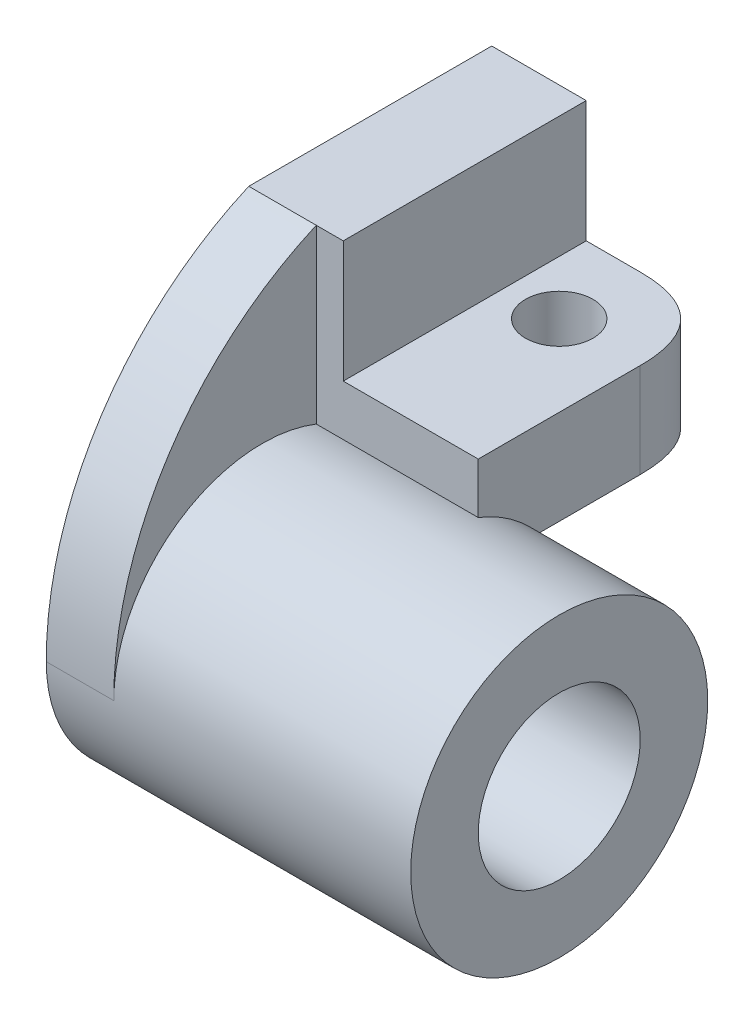
from build123d import *

# Parameters (mm, degrees)
SKETCH1_R           = 34.925
SKETCH1_R_2         = 19.05
BOSS_EXTRUDE1_DEPTH = 85.725
BOSS_EXTRUDE2_DEPTH = 53.975
SKETCH1_4_W         = 57.15
SKETCH1_4_H         = 28.575
BOSS_EXTRUDE3_DEPTH = 22.225
BOSS_EXTRUDE4_DEPTH = 15.875
FILLET1_SIZE        = 19.05
SKETCH2_R           = 7.9375
CUT_EXTRUDE1_DEPTH  = 137.118289601


with BuildPart() as part:
    # Sketch1 → Boss-Extrude1 (new body)
    with BuildSketch(Plane(origin=(0, 0, 0), x_dir=(0, 0, -1), z_dir=(1, 0, 0))):
        Circle(SKETCH1_R)
        Circle(SKETCH1_R_2, mode=Mode.SUBTRACT)
    extrude(amount=BOSS_EXTRUDE1_DEPTH)

    # Sketch1<3> → Boss-Extrude2 (add)
    with BuildSketch(Plane(origin=(0, 0, 0), x_dir=(0, 0, -1), z_dir=(1, 0, 0))):
        with BuildLine():
            Line((69.85, 44.45), (12.7, 44.45))
            Line((12.7, 44.45), (12.7, 32.534068682))
            ThreePointArc((12.7, 32.534068682), (20.479669269, 28.290259306), (26.940768363, 22.225))
            Line((26.940768363, 22.225), (69.85, 22.225))
            Line((69.85, 22.225), (69.85, 44.45))
        make_face()
    extrude(amount=BOSS_EXTRUDE2_DEPTH)

    # Sketch1<4> → Boss-Extrude3 (add)
    with BuildSketch(Plane(origin=(0, 0, 0), x_dir=(0, 0, -1), z_dir=(1, 0, 0))):
        with Locations((41.275, 58.7375)):
            Rectangle(SKETCH1_4_W, SKETCH1_4_H)
    extrude(amount=BOSS_EXTRUDE3_DEPTH)

    # Sketch1<5> → Boss-Extrude4 (add)
    with BuildSketch(Plane(origin=(0, 0, 0), x_dir=(0, 0, -1), z_dir=(1, 0, 0))):
        with BuildLine():
            Line((12.7, 32.534068682), (12.7, 44.45))
            Line((12.7, 44.45), (12.7, 73.025))
            ThreePointArc((12.7, 73.025), (-22.035822369, 43.636405893), (-34.925, 0))
            ThreePointArc((-34.925, 0), (-19.700356913, 28.838369623), (12.7, 32.534068682))
        make_face()
    extrude(amount=BOSS_EXTRUDE4_DEPTH)

    # Fillet1
    # a fillet whose section is not a circle: 19.05 mm, written as the material it takes off along each edge
    with BuildSketch(Plane(origin=(53.975, -25.4, -69.85), x_dir=(0, 0, 1), z_dir=(0, 1, 0))) as fillet1_piece_1:
        with BuildLine():
            Bezier((FILLET1_SIZE, 0), (0, 0), (0, -FILLET1_SIZE), weights=[1, 1, 1])
            Line((0, -FILLET1_SIZE), (0, 0))
            Line((0, 0), (FILLET1_SIZE, 0))
        make_face()
    extrude(amount=117.475, mode=Mode.SUBTRACT)

    # Sketch2 → Cut-Extrude1 (cut, through all)
    with BuildSketch(Plane(origin=(0, 44.45, 0), x_dir=(1, 0, 0), z_dir=(0, 1, 0))):
        with Locations(Location((34.925, 50.8, 0), (0, 0, 270))):
            Circle(SKETCH2_R)
    extrude(amount=-CUT_EXTRUDE1_DEPTH, mode=Mode.SUBTRACT)


solid = part.part
